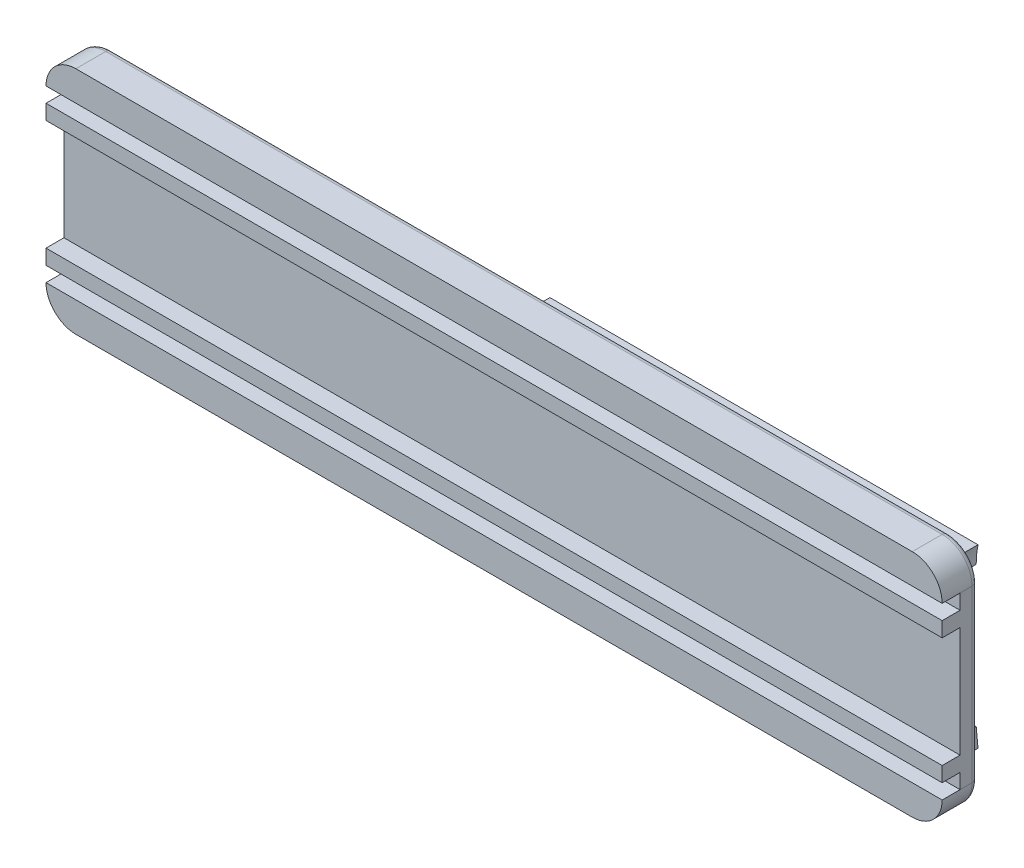
from build123d import *

# Parameters (mm, degrees)
Y_KSEKLIK_EKSTR_ZYON1_DEPTH   = 10
Y_KSEKLIK_EKSTR_ZYON1_2_DEPTH = 10
IZIM2_W                       = 300
IZIM2_H                       = 77
Y_KSEKLIK_EKSTR_ZYON2_DEPTH   = 12
RADYUS1_R                     = 10
IZIM3_W                       = 300
IZIM3_H                       = 37
KES_EKSTR_ZYON2_DEPTH         = 6
IZIM4_W                       = 300
IZIM4_H                       = 5
KES_EKSTR_ZYON3_DEPTH         = 6
RADYUS2_R                     = 2


with BuildPart() as part:
    # Çizim1 → Yükseklik-Ekstrüzyon1 (new body)
    with BuildSketch(Plane.XY):
        Polygon((-92.794429091, -56), (45.396546667, -56), (46, -62), (-97.305663005, -62), (-97.305663005, -56), align=None)
    extrude(amount=Y_KSEKLIK_EKSTR_ZYON1_DEPTH)



with BuildPart() as body_2:
    # Çizim1 → Y_kseklik-Ekstr_zyon1 2 (new body)
    with BuildSketch(Plane.XY):
        with BuildLine():
            Line((-92.794429091, -9), (45.396546667, -9))
            ThreePointArc((45.396546667, -9), (45.547789595, -5.984865014), (46, -3))
            Line((46, -3), (-97.305663005, -3))
            Line((-97.305663005, -3), (-97.305663005, -9))
            Line((-97.305663005, -9), (-92.794429091, -9))
        make_face()
    extrude(amount=Y_KSEKLIK_EKSTR_ZYON1_2_DEPTH)


with BuildPart() as part_1:
    add(part.part)

    add(body_2.part)  # Yükseklik-Ekstrüzyon2 merges body 2
    # Çizim2 → Yükseklik-Ekstrüzyon2 (add)
    with BuildSketch(Plane.XY.offset(10)):
        with Locations((-94, -32.5)):
            Rectangle(IZIM2_W, IZIM2_H)
    extrude(amount=Y_KSEKLIK_EKSTR_ZYON2_DEPTH)

    # Radyus1
    radyus1_edges = [part_1.edges().sort_by_distance(p)[0] for p in [
        (56, -71, 16),
        (56, 6, 16),
        (-244, 6, 16),
        (-244, -71, 16),
    ]]
    fillet(radyus1_edges, radius=RADYUS1_R)

    # Çizim3 → Kes-Ekstrüzyon2 (cut)
    with BuildSketch(Plane.XY.offset(22)):
        with Locations((-94, -32.5)):
            Rectangle(IZIM3_W, IZIM3_H)
    extrude(amount=-KES_EKSTR_ZYON2_DEPTH, mode=Mode.SUBTRACT)

    # Çizim4 → Kes-Ekstrüzyon3 (cut)
    with BuildSketch(Plane.XY.offset(22)):
        with Locations((-94, -58.5)):
            Rectangle(IZIM4_W, IZIM4_H)
        with Locations((-94, -6.5)):
            Rectangle(IZIM4_W, IZIM4_H)
    extrude(amount=-KES_EKSTR_ZYON3_DEPTH, mode=Mode.SUBTRACT)

    # Radyus2
    radyus2_edges = [part_1.edges().sort_by_distance(p)[0] for p in [
        (-241.071067812, -68.071067812, 10),
        (-244, -32.5, 10),
        (-241.071067812, 3.071067812, 10),
        (-94, 6, 10),
        (53.071067812, 3.071067812, 10),
        (56, -32.5, 10),
        (53.071067812, -68.071067812, 10),
        (-94, -71, 10),
    ]]
    fillet(radyus2_edges, radius=RADYUS2_R)


solid = part_1.part
